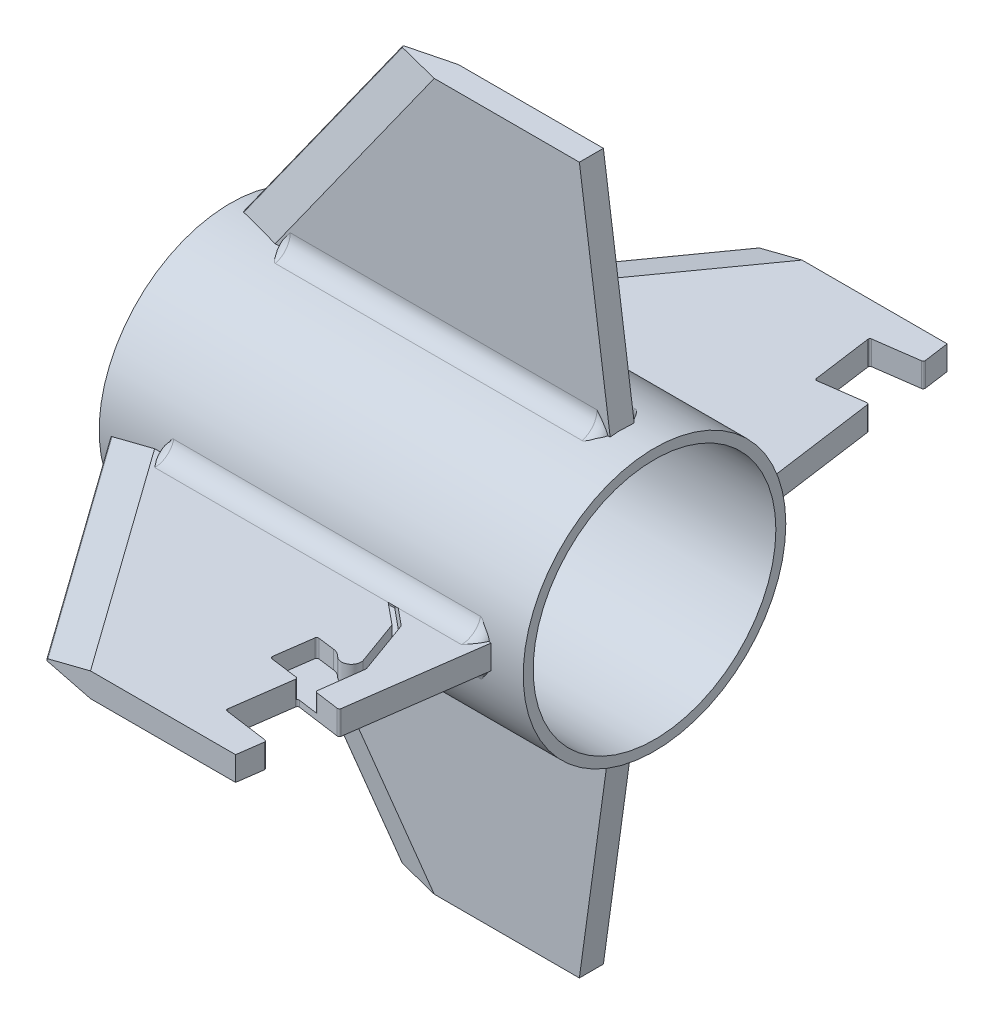
from build123d import *

# Parameters (mm, degrees)
BOSS_EXTRUDE1_DEPTH         = 9.525
CUT_EXTRUDE11_DEPTH         = 109.249530891
CUT_EXTRUDE12_DEPTH         = 109.249530891
CUT_EXTRUDE1_DEPTH          = 164.459241155
FILLET25_R                  = 0.79375
CUT_EXTRUDE8_DEPTH          = 7.112
FILLET31_R                  = 0.79375
FILLET32_R                  = 0.5
BOSS_EXTRUDE7_DEPTH         = 120.5
BOSS_EXTRUDE7_DEPTH_BACK    = 47.440944882
SKETCH20_R                  = 52
CIRPATTERN6_COUNT           = 2
BOSS_EXTRUDE11_DEPTH        = 4.7625
BOSS_EXTRUDE11_DEPTH_BACK   = 4.7625
BOSS_EXTRUDE11_2_DEPTH      = 4.7625
BOSS_EXTRUDE11_2_DEPTH_BACK = 4.7625
CUT_EXTRUDE14_START         = 11
CUT_EXTRUDE14_DEPTH         = 154.474756751
CUT_EXTRUDE15_DEPTH         = 109.249530891
SKETCH24_R                  = 48.067269017
CUT_EXTRUDE16_DEPTH         = 167.940945
BOSS_EXTRUDE13_START        = -144.5
BOSS_EXTRUDE13_DEPTH        = 131.5
BOSS_EXTRUDE13_2_DEPTH      = 131.5
FILLET17_ANGLE              = 76.317927
CIRPATTERN9_COUNT           = 4
FILLET33_R                  = 0.5
FILLET34_R                  = 0.5


with BuildPart() as part:
    # Sketch2 → Boss-Extrude1 (new body)
    with BuildSketch(Plane(origin=(0, 0, 0), x_dir=(1, 0, 0), z_dir=(0, 1, 0))):
        Polygon((95.501036211, 33.603610094), (107.801036211, 122.503610094), (-44.198963789, 122.503610094), (19.301036211, 33.603610094), align=None)
    extrude(amount=BOSS_EXTRUDE1_DEPTH)

    # Sketch40 → Cut-Extrude11 (cut, along a direction that is not the sketch's normal)
    with BuildSketch(Plane(origin=(0, 0, -122.503610094), x_dir=(-1, 0, 0), z_dir=(0, 0, -1))):
        Polygon((44.198963789, 4.7625), (25.464097027, 0), (44.198963789, 0), align=None)
    extrude(amount=-CUT_EXTRUDE11_DEPTH, dir=(-0.5812381937190961, 0, -0.8137334712067352), mode=Mode.SUBTRACT)

    # Sketch41 → Cut-Extrude12 (cut, along a direction that is not the sketch's normal)
    with BuildSketch(Plane(origin=(0, 0, -122.503610094), x_dir=(-1, 0, 0), z_dir=(0, 0, -1))):
        Polygon((44.198963789, 4.7625), (44.198963789, 9.525), (25.464097027, 9.525), align=None)
    extrude(amount=-CUT_EXTRUDE12_DEPTH, dir=(-0.5812381937190961, 0, -0.8137334712067352), mode=Mode.SUBTRACT)

    # Sketch3 → Cut-Extrude1 (cut, through all)
    with BuildSketch(Plane(origin=(0, 9.525, 0), x_dir=(1, 0, 0), z_dir=(0, 1, 0))):
        Polygon((96.991616373, 44.376990288), (78.121375316, 46.987833539), (81.602499651, 72.148154947), (100.472740707, 69.537311696), align=None)
    extrude(amount=-CUT_EXTRUDE1_DEPTH, mode=Mode.SUBTRACT)

    # Fillet25
    fillet25_edges = [part.edges().sort_by_distance(p)[0] for p in [
        (100.472740707, 4.7625, -69.537311696),
        (96.991616373, 4.7625, -44.376990288),
        (78.121375316, 4.7625, -46.987833539),
        (81.602499651, 4.7625, -72.148154947),
    ]]
    fillet(fillet25_edges, radius=FILLET25_R)

    # Sketch4 → Cut-Extrude8 (cut)
    with BuildSketch(Plane(origin=(0, 9.525, 0), x_dir=(1, 0, 0), z_dir=(0, 1, 0))):
        with BuildLine():
            Line((91.432981633, 84.938583056), (91.87398018, 88.3325177))
            ThreePointArc((91.87398018, 88.3325177), (91.880119161, 88.935768076), (91.743819438, 89.523450889))
            Line((91.743819438, 89.523450889), (84.365995583, 109.929022071))
            ThreePointArc((84.365995583, 109.929022071), (84.052194516, 110.530485922), (83.590381446, 111.027435178))
            Line((83.590381446, 111.027435178), (69.63117281, 122.503610094))
            Line((69.63117281, 122.503610094), (65.631546235, 122.503610094))
            Line((65.631546235, 122.503610094), (81.977330858, 109.065378145))
            Line((81.977330858, 109.065378145), (88.524922018, 90.956062972))
            ThreePointArc((88.524922018, 90.956062972), (86.871368444, 87.055321455), (82.635738177, 86.958058718))
            ThreePointArc((82.635738177, 86.958058718), (82.108570303, 87.435753172), (81.573856943, 87.904986143))
            ThreePointArc((81.573856943, 87.904986143), (80.279037974, 88.75135311), (78.792534366, 89.179372068))
            Line((78.792534366, 89.179372068), (71.259162002, 90.172380139))
            Line((71.259162002, 90.172380139), (70.399965305, 83.95114873))
            Line((70.399965305, 83.95114873), (68.995626594, 73.78267842))
            Line((68.995626594, 73.78267842), (81.599351809, 72.105893611))
            Line((81.599351809, 72.105893611), (81.450209567, 70.968016338))
            Line((81.450209567, 70.968016338), (82.559812791, 70.82309653))
            Line((82.559812791, 70.82309653), (82.351161676, 69.22552369))
            Line((82.351161676, 69.22552369), (86.280730255, 68.712302106))
            Line((86.280730255, 68.712302106), (86.63642856, 71.435766832))
            Line((86.63642856, 71.435766832), (89.626769646, 71.037935364))
            Line((89.626769646, 71.037935364), (91.432981633, 84.938583056))
        make_face()
    extrude(amount=-CUT_EXTRUDE8_DEPTH, mode=Mode.SUBTRACT)

    # Fillet31
    # the kernel refuses this fillet: 0.79375 mm, written as the material it adds along each edge
    with BuildSketch(Plane(origin=(71.259162002, 9.525, -90.172380139), x_dir=(0.9914240578116118, 0, 0.13068411377194142), z_dir=(0, -1, 0))) as fillet31_piece_1:
        with BuildLine():
            CenterArc((FILLET31_R * 0.993838975456, FILLET31_R), FILLET31_R, 180.35409036, 89.64590964)
            Line((-FILLET31_R * 0.00614192814136, FILLET31_R * 0.993819996707), (0, 0))
            Line((0, 0), (FILLET31_R * 0.993838975456, 0))
        make_face()
    extrude(amount=9.084149217)
    with BuildSketch(Plane(origin=(68.995626594, 9.525, -73.78267842), x_dir=(0.13680862211806724, 0, -0.9905974969250406), z_dir=(0, -1, 0))) as fillet31_piece_2:
        with BuildLine():
            CenterArc((FILLET31_R * 1.00498928997, FILLET31_R), FILLET31_R, 179.714846688, 90.285153312)
            Line((FILLET31_R * 0.00500167453449, FILLET31_R * 1.00497684362), (0, 0))
            Line((0, 0), (FILLET31_R * 1.00498928997, 0))
        make_face()
    extrude(amount=9.106275622)
    # the kernel refuses this fillet: 0.79375 mm, written as the material it takes off along each edge
    with BuildSketch(Plane(origin=(89.626769646, 11.493028645, -71.037935364), x_dir=(0.9905638349724125, 0, 0.13705213914692133), z_dir=(0, -1, 0))) as fillet31_2_piece_1:
        with BuildLine():
            CenterArc((FILLET31_R * 0.991762466743, -FILLET31_R), FILLET31_R, 90, 89.526074815)
            Line((-FILLET31_R * 0.00820332414174, -FILLET31_R * 0.991728539427), (0, 0))
            Line((0, 0), (FILLET31_R * 0.991762466743, 0))
        make_face()
    extrude(amount=9.080028645, mode=Mode.SUBTRACT)
    with BuildSketch(Plane(origin=(81.599351809, 11.470712134, -72.105893611), x_dir=(-0.99126610392599, 0, -0.1318768789719729), z_dir=(0, -1, 0))) as fillet31_2_piece_2:
        with BuildLine():
            CenterArc((0.778284853, -0.79375), FILLET31_R, 90, 79.138737607)
            Line((-0.001246175, -0.644182498), (0, 0))
            Line((0, 0), (0.778284853, 0))
        make_face()
    extrude(amount=9.057712134, mode=Mode.SUBTRACT)

    # Fillet32
    fillet32_edges = [part.edges().sort_by_distance(p)[0] for p in [
        (-12.448963789, 4.7625, -78.053610094),
    ]]
    fillet(fillet32_edges, radius=FILLET32_R)


with BuildPart() as body_2:
    # Sketch20 → Boss-Extrude7 (new, two sides: drawn at the far end of the back side and taken through both)
    with BuildSketch(Plane(origin=(0, 0, 0), x_dir=(0, 0, -1), z_dir=(1, 0, 0)).offset(-BOSS_EXTRUDE7_DEPTH_BACK)):
        with Locations((174.503610094, 4.7625)):
            Circle(SKETCH20_R)
    extrude(amount=BOSS_EXTRUDE7_DEPTH + BOSS_EXTRUDE7_DEPTH_BACK)

    # Sketch24 → Cut-Extrude16 (cut)
    with BuildSketch(Plane(origin=(120.5, 0, 0), x_dir=(0, 0, -1), z_dir=(1, 0, 0))):
        with Locations((174.503610094, 4.7625)):
            Circle(SKETCH24_R)
    extrude(amount=-CUT_EXTRUDE16_DEPTH, mode=Mode.SUBTRACT)


with BuildPart() as cirpattern6_1:
    # CirPattern6: pattern copy
    add(part.part.rotate(Axis((0, 4.7625, -174.503610094), (1, 0, 0)), 1 * 360 / CIRPATTERN6_COUNT))


with BuildPart() as body_4:
    # Sketch35 → Boss-Extrude11 (new, two sides: drawn at the far end of the back side and taken through both)
    with BuildSketch(Plane(origin=(0, 0, -174.503610094), x_dir=(-1, 0, 0), z_dir=(0, 0, -1)).offset(-BOSS_EXTRUDE11_DEPTH_BACK)):
        Polygon((44.198963789, -46.2375), (-107.801036211, -46.2375), (-95.501036211, -135.1375), (-19.301036211, -135.1375), align=None)
    extrude(amount=BOSS_EXTRUDE11_DEPTH + BOSS_EXTRUDE11_DEPTH_BACK)

    # Cut-Extrude14: read off the stored shape, not the designer's step
    # Cut-Extrude14 outline → Cut-Extrude14 (cut)
    with BuildSketch(Plane(origin=(0, 0, 0), x_dir=(0.8137334712067363, 0.5812381937190946, 0), z_dir=(0.5812381937190946, -0.8137334712067362, 0)).offset(CUT_EXTRUDE14_START)):
        Polygon((-62.84117721, -179.266110094), (-47.595989016, -179.266110094), (-62.84117721, -174.503610094), align=None)
        Polygon((-62.84117721, -169.741110094), (-62.84117721, -174.503610094), (-47.595989016, -169.741110094), align=None)
    extrude(amount=CUT_EXTRUDE14_DEPTH, mode=Mode.SUBTRACT)

    # Fillet33
    fillet33_edges = [body_4.edges().sort_by_distance(p)[0] for p in [
        (-12.448963789, -90.6875, -174.503610094),
    ]]
    fillet(fillet33_edges, radius=FILLET33_R)


with BuildPart() as body_5:
    # Sketch35 → Boss-Extrude11 2 (new, two sides: drawn at the far end of the back side and taken through both)
    with BuildSketch(Plane(origin=(0, 0, -174.503610094), x_dir=(-1, 0, 0), z_dir=(0, 0, -1)).offset(-BOSS_EXTRUDE11_2_DEPTH_BACK)):
        Polygon((-95.501036211, 144.6625), (-107.801036211, 55.7625), (44.198963789, 55.7625), (-19.301036211, 144.6625), align=None)
    extrude(amount=BOSS_EXTRUDE11_2_DEPTH + BOSS_EXTRUDE11_2_DEPTH_BACK)

    # Sketch44 → Cut-Extrude15 (cut, along a direction that is not the sketch's normal)
    with BuildSketch(Plane.XZ.offset(-55.7625)):
        Polygon((-44.198963789, -169.741110094), (-44.198963789, -174.503610094), (-25.464096989, -169.741110094), align=None)
        Polygon((-25.464096989, -179.266110094), (-44.198963789, -174.503610094), (-44.198963789, -179.266110094), align=None)
    extrude(amount=-CUT_EXTRUDE15_DEPTH, dir=(-0.5812381937190975, -0.8137334712067342, 0), mode=Mode.SUBTRACT)

    # Fillet34
    fillet34_edges = [body_5.edges().sort_by_distance(p)[0] for p in [
        (-12.448963789, 100.2125, -174.503610094),
    ]]
    fillet(fillet34_edges, radius=FILLET34_R)


with BuildPart() as body_6:
    # Sketch47 → Boss-Extrude13 (new body)
    with BuildSketch(Plane(origin=(120.5, 0, 0), x_dir=(0, 0, -1), z_dir=(1, 0, 0)).offset(BOSS_EXTRUDE13_START)):
        with BuildLine():
            Line((169.741110094, 56.468393399), (163.810201803, 55.654585371))
            ThreePointArc((163.810201803, 55.654585371), (168.081004653, 58.40295046), (169.741110094, 63.202671033))
            Line((169.741110094, 63.202671033), (169.741110094, 56.468393399))
        make_face()
    extrude(amount=BOSS_EXTRUDE13_DEPTH)

    # Fillet17: read off the stored shape, not the designer's step
    # Fillet17 outline → Fillet17 (revolve, cut)
    with BuildSketch(Plane(origin=(0, 63.202671033, -161.972547018), x_dir=(0, -0.9716231773625535, -0.23653414386066077), z_dir=(0, -0.23653414386066077, 0.9716231773625535))):
        with BuildLine():
            Line((7.768563076, -19), (7.768563076, -24))
            Line((7.768563076, -24), (10.281102447, -24))
            Line((10.281102447, -24), (10.281102447, -23.33734246))
            ThreePointArc((10.281102447, -23.33734246), (8.442057376, -21.506261843), (7.768563076, -19))
        make_face()
        with BuildLine():
            ThreePointArc((7.768563076, 102.5), (8.442057376, 105.006261843), (10.281102447, 106.83734246))
            Line((10.281102447, 106.83734246), (10.281102447, 107.5))
            Line((10.281102447, 107.5), (7.768563076, 107.5))
            Line((7.768563076, 107.5), (7.768563076, 102.5))
        make_face()
    revolve(axis=Axis((0, 63.202671033, -161.972547018), (1, 0, 0)), revolution_arc=FILLET17_ANGLE, mode=Mode.SUBTRACT)


with BuildPart() as body_7:
    # Sketch47 → Boss-Extrude13 2 (new body)
    with BuildSketch(Plane(origin=(120.5, 0, 0), x_dir=(0, 0, -1), z_dir=(1, 0, 0)).offset(BOSS_EXTRUDE13_START)):
        with BuildLine():
            Line((179.266110094, 63.202671033), (179.266110094, 56.468393399))
            Line((179.266110094, 56.468393399), (185.197018384, 55.654585371))
            ThreePointArc((185.197018384, 55.654585371), (180.926215534, 58.40295046), (179.266110094, 63.202671033))
        make_face()
    extrude(amount=BOSS_EXTRUDE13_2_DEPTH)

    # Fillet35: read off the stored shape, not the designer's step
    # Fillet35 outline → Fillet35 (revolve, cut)
    with BuildSketch(Plane(origin=(0, 63.202671033, -187.03467317), x_dir=(0, 1, 0), z_dir=(0, 0, -1))):
        with BuildLine():
            ThreePointArc((10.281102447, -23.33734246), (8.442057376, -21.506261843), (7.768563076, -19))
            Line((7.768563076, -19), (7.768563076, -24))
            Line((7.768563076, -24), (10.281102447, -24))
            Line((10.281102447, -24), (10.281102447, -23.33734246))
        make_face()
        with BuildLine():
            ThreePointArc((7.768563076, 102.5), (8.442057376, 105.006261843), (10.281102447, 106.83734246))
            Line((10.281102447, 106.83734246), (10.281102447, 107.5))
            Line((10.281102447, 107.5), (7.768563076, 107.5))
            Line((7.768563076, 107.5), (7.768563076, 102.5))
        make_face()
    revolve(axis=Axis((0, 63.202671033, -187.03467317), (1, 0, 0)), mode=Mode.SUBTRACT)


with BuildPart() as cirpattern9_1:
    # CirPattern9: pattern copy
    add(body_7.part.rotate(Axis((0, 4.7625, -174.503610094), (1, 0, 0)), 1 * 360 / CIRPATTERN9_COUNT))


with BuildPart() as cirpattern9_2:
    # CirPattern9: pattern copy
    add(body_7.part.rotate(Axis((0, 4.7625, -174.503610094), (1, 0, 0)), 2 * 360 / CIRPATTERN9_COUNT))


with BuildPart() as cirpattern9_3:
    # CirPattern9: pattern copy
    add(body_7.part.rotate(Axis((0, 4.7625, -174.503610094), (1, 0, 0)), 3 * 360 / CIRPATTERN9_COUNT))


with BuildPart() as cirpattern9_4:
    # CirPattern9: pattern copy
    add(body_6.part.rotate(Axis((0, 4.7625, -174.503610094), (1, 0, 0)), 1 * 360 / CIRPATTERN9_COUNT))


with BuildPart() as cirpattern9_5:
    # CirPattern9: pattern copy
    add(body_6.part.rotate(Axis((0, 4.7625, -174.503610094), (1, 0, 0)), 2 * 360 / CIRPATTERN9_COUNT))


with BuildPart() as cirpattern9_6:
    # CirPattern9: pattern copy
    add(body_6.part.rotate(Axis((0, 4.7625, -174.503610094), (1, 0, 0)), 3 * 360 / CIRPATTERN9_COUNT))


solid = Compound([part.part, body_2.part, cirpattern6_1.part, body_4.part, body_5.part, body_6.part, body_7.part, cirpattern9_1.part, cirpattern9_2.part, cirpattern9_3.part, cirpattern9_4.part, cirpattern9_5.part, cirpattern9_6.part])
